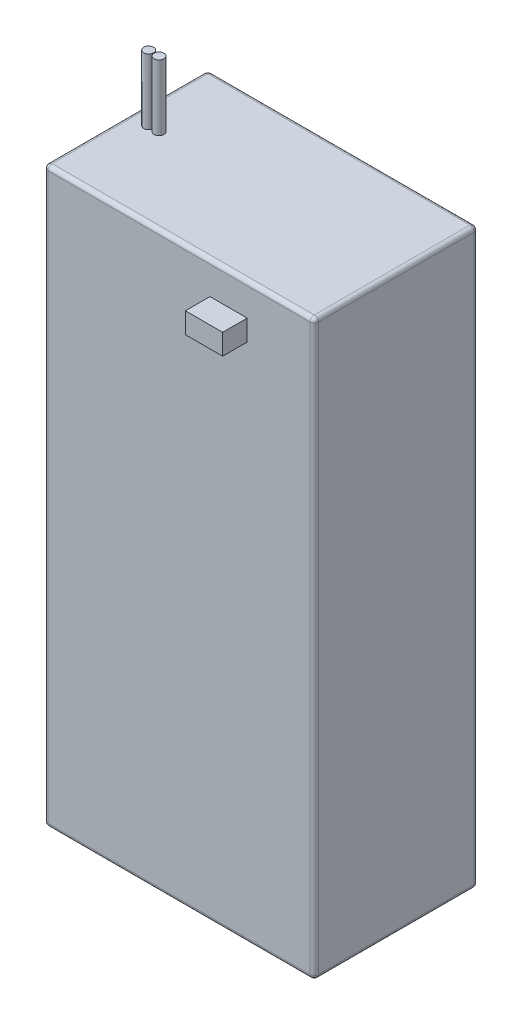
from build123d import *

# Parameters (mm, degrees)
SKETCH1_W           = 33
SKETCH1_H           = 70
BOSS_EXTRUDE1_DEPTH = 20
FILLET1_R           = 0.5
SKETCH2_R           = 0.6
WIRES_2_DEPTH       = 8
SKETCH3_W           = 4.550623551
SKETCH3_H           = 2.528124195
POWER_SWITCH_DEPTH  = 3


with BuildPart() as part:
    # Sketch1 → Boss-Extrude1 (new body)
    with BuildSketch(Plane.XY):
        Rectangle(SKETCH1_W, SKETCH1_H)
    extrude(amount=BOSS_EXTRUDE1_DEPTH)

    # Fillet1
    fillet1_edges = [part.edges().sort_by_distance(p)[0] for p in [
        (-16.5, -35, 10),
        (16.5, -35, 10),
        (16.5, 35, 10),
        (-16.5, 35, 10),
        (0, 35, 0),
        (-16.5, 0, 0),
        (0, -35, 0),
        (16.5, 0, 0),
        (0, -35, 20),
        (-16.5, 0, 20),
        (0, 35, 20),
        (16.5, 0, 20),
    ]]
    fillet(fillet1_edges, radius=FILLET1_R)

    # Sketch2 → Wires 2 (add)
    with BuildSketch(Plane(origin=(0, 35, 0), x_dir=(1, 0, 0), z_dir=(0, 1, 0))):
        with Locations((-14.124921584, -9.591772622)):
            Circle(SKETCH2_R)
        with Locations((-12.864771316, -9.591772622)):
            Circle(SKETCH2_R)
    extrude(amount=WIRES_2_DEPTH)

    # Sketch3 → Power Switch (add)
    with BuildSketch(Plane.XY.offset(20)):
        with Locations((6.042216827, 29.812148032)):
            Rectangle(SKETCH3_W, SKETCH3_H)
    extrude(amount=POWER_SWITCH_DEPTH)


solid = part.part
